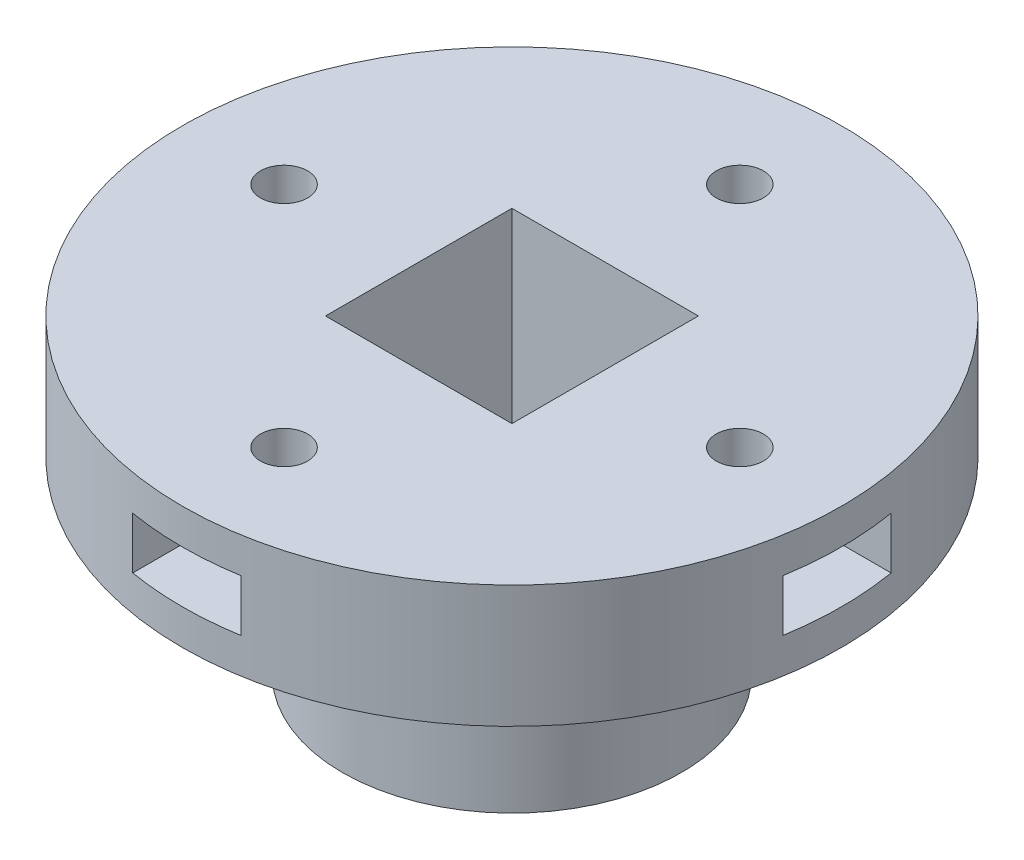
from build123d import *

# Parameters (mm, degrees)
SKETCH1_R               = 9
SKETCH1_W               = 9.9
SKETCH1_H               = 9.9
BOSS_EXTRUDE1_DEPTH     = 10
SKETCH2_R               = 17.5
BOSS_EXTRUDE2_DEPTH     = 6.5
CUT_EXTRUDE1_REACH      = 28.693
SKETCH3_R               = 1.25
CUT_EXTRUDE2_DEPTH      = 30.744747435
CUT_EXTRUDE2_DEPTH_BACK = 30.744747435
SKETCH4_R               = 1.5
CUT_EXTRUDE3_DEPTH      = 10
CUT_EXTRUDE3_DEPTH_BACK = 10
SKETCH6_W               = 9.9
SKETCH6_H               = 9.9
SKETCH8_W               = 5.75
SKETCH8_H               = 2.75
CUT_EXTRUDE4_DEPTH      = 5
CUT_EXTRUDE5_DEPTH      = 2.75
CIRPATTERN1_START       = 11.875
CIRPATTERN1_OUTLINE_R   = 1.25
CIRPATTERN1_DEPTH       = 2.75


# Read off the part's stored shape, not the designer's step: CirPattern1
with BuildPart() as part:
    # Sketch1 → Boss-Extrude1 (new body)
    with BuildSketch(Plane(origin=(0, 0, 0), x_dir=(1, 0, 0), z_dir=(0, 1, 0))):
        with Locations(Location((0, 0, 0), (0, 0, 270))):
            Circle(SKETCH1_R)
        Rectangle(SKETCH1_W, SKETCH1_H, mode=Mode.SUBTRACT)
    extrude(amount=BOSS_EXTRUDE1_DEPTH)

    # Sketch2 → Boss-Extrude2 (add)
    with BuildSketch(Plane(origin=(0, 10, 0), x_dir=(1, 0, 0), z_dir=(0, 1, 0))):
        with Locations(Location((0, 0, 0), (0, 0, 90))):
            Circle(SKETCH2_R)
    extrude(amount=BOSS_EXTRUDE2_DEPTH)

    # Sketch3 → Cut-Extrude1 (cut, up to next)
    with BuildSketch(Plane.XZ.offset(-10), mode=Mode.PRIVATE) as cut_extrude1_sk1:
        with Locations(Location((12.1, 0, 0), (0, 0, 270))):
            Circle(SKETCH3_R)
    cut_extrude1_tool1 = extrude(cut_extrude1_sk1.sketch, amount=-CUT_EXTRUDE1_REACH, mode=Mode.PRIVATE) & part.part
    # Sketch3 → Cut-Extrude1 (cut, up to next)
    with BuildSketch(Plane.XZ.offset(-10), mode=Mode.PRIVATE) as cut_extrude1_sk2:
        with Locations(Location((0, -12.1, 0), (0, 0, 270))):
            Circle(SKETCH3_R)
    cut_extrude1_tool2 = extrude(cut_extrude1_sk2.sketch, amount=-CUT_EXTRUDE1_REACH, mode=Mode.PRIVATE) & part.part
    # Sketch3 → Cut-Extrude1 (cut, up to next)
    with BuildSketch(Plane.XZ.offset(-10), mode=Mode.PRIVATE) as cut_extrude1_sk3:
        with Locations(Location((-12.1, 0, 0), (0, 0, 270))):
            Circle(SKETCH3_R)
    cut_extrude1_tool3 = extrude(cut_extrude1_sk3.sketch, amount=-CUT_EXTRUDE1_REACH, mode=Mode.PRIVATE) & part.part
    # Sketch3 → Cut-Extrude1 (cut, up to next)
    with BuildSketch(Plane.XZ.offset(-10), mode=Mode.PRIVATE) as cut_extrude1_sk4:
        with Locations(Location((0, 12.1, 0), (0, 0, 270))):
            Circle(SKETCH3_R)
    cut_extrude1_tool4 = extrude(cut_extrude1_sk4.sketch, amount=-CUT_EXTRUDE1_REACH, mode=Mode.PRIVATE) & part.part
    add(cut_extrude1_tool1.solids().sort_by_distance((12.1, 10, 0))[0], mode=Mode.SUBTRACT)
    add(cut_extrude1_tool2.solids().sort_by_distance((0, 10, -12.1))[0], mode=Mode.SUBTRACT)
    add(cut_extrude1_tool3.solids().sort_by_distance((-12.1, 10, 0))[0], mode=Mode.SUBTRACT)
    add(cut_extrude1_tool4.solids().sort_by_distance((0, 10, 12.1))[0], mode=Mode.SUBTRACT)

    # Sketch4 → Cut-Extrude2 (cut, two sides: drawn at the far end of the back side and taken through both)
    with BuildSketch(Plane.XY.offset(-CUT_EXTRUDE2_DEPTH_BACK)):
        with Locations((0, 4.916404418)):
            Circle(SKETCH4_R)
    extrude(amount=CUT_EXTRUDE2_DEPTH + CUT_EXTRUDE2_DEPTH_BACK, mode=Mode.SUBTRACT)

    # Sketch6 → Cut-Extrude3 (cut, two sides: drawn at the far end of the back side and taken through both)
    with BuildSketch(Plane(origin=(0, 10, 0), x_dir=(-1, 0, 0), z_dir=(0, -1, 0)).offset(-CUT_EXTRUDE3_DEPTH_BACK)):
        Rectangle(SKETCH6_W, SKETCH6_H)
    extrude(amount=CUT_EXTRUDE3_DEPTH + CUT_EXTRUDE3_DEPTH_BACK, mode=Mode.SUBTRACT)

    # Sketch8 → Cut-Extrude4 (cut)
    with BuildSketch(Plane(origin=(17.5, 0, 0), x_dir=(0, 0, -1), z_dir=(1, 0, 0))):
        with Locations((0, 13.25)):
            Rectangle(SKETCH8_W, SKETCH8_H)
    extrude(amount=-CUT_EXTRUDE4_DEPTH, mode=Mode.SUBTRACT)

    # Sketch9 → Cut-Extrude5 (cut)
    with BuildSketch(Plane.XZ.offset(-14.625)):
        Polygon((15.419764048, 0), (13.759882024, 2.875), (10.440117976, 2.875), (8.780235952, 0), (10.440117976, -2.875), (13.759882024, -2.875), align=None)
    extrude(amount=CUT_EXTRUDE5_DEPTH, mode=Mode.SUBTRACT)

    # CirPattern1 outline → CirPattern1 (cut)
    # profile 1 of 3: a face of its own
    with BuildSketch(Plane(origin=(0, 0, 0), x_dir=(1, 0, 0), z_dir=(0, 1, 0)).offset(CIRPATTERN1_START)):
        with BuildLine():
            Line((-8.780235952, 0), (-10.440117976, 2.875))
            Line((-10.440117976, 2.875), (-17.26222393, 2.875))
            ThreePointArc((-17.26222393, 2.875), (-17.5, 0), (-17.26222393, -2.875))
            Line((-17.26222393, -2.875), (-10.440117976, -2.875))
            Line((-10.440117976, -2.875), (-8.780235952, 0))
        make_face()
        with Locations((-12.1, 0)):
            Circle(CIRPATTERN1_OUTLINE_R, mode=Mode.SUBTRACT)
    # profile 2 of 3: a face of its own
    with BuildSketch(Plane(origin=(0, 0, 0), x_dir=(1, 0, 0), z_dir=(0, 1, 0)).offset(CIRPATTERN1_START)):
        with BuildLine():
            ThreePointArc((2.875, 17.26222393), (0, 17.5), (-2.875, 17.26222393))
            Line((-2.875, 17.26222393), (-2.875, 10.440117976))
            Line((-2.875, 10.440117976), (0, 8.780235952))
            Line((0, 8.780235952), (2.875, 10.440117976))
            Line((2.875, 10.440117976), (2.875, 17.26222393))
        make_face()
        with Locations((0, 12.1)):
            Circle(CIRPATTERN1_OUTLINE_R, mode=Mode.SUBTRACT)
    # profile 3 of 3: a face of its own
    with BuildSketch(Plane(origin=(0, 0, 0), x_dir=(1, 0, 0), z_dir=(0, 1, 0)).offset(CIRPATTERN1_START)):
        with BuildLine():
            Line((-2.875, -10.440117976), (-2.875, -17.26222393))
            ThreePointArc((-2.875, -17.26222393), (0, -17.5), (2.875, -17.26222393))
            Line((2.875, -17.26222393), (2.875, -10.440117976))
            Line((2.875, -10.440117976), (0, -8.780235952))
            Line((0, -8.780235952), (-2.875, -10.440117976))
        make_face()
        with Locations((0, -12.1)):
            Circle(CIRPATTERN1_OUTLINE_R, mode=Mode.SUBTRACT)
    extrude(amount=CIRPATTERN1_DEPTH, mode=Mode.SUBTRACT)


solid = part.part
